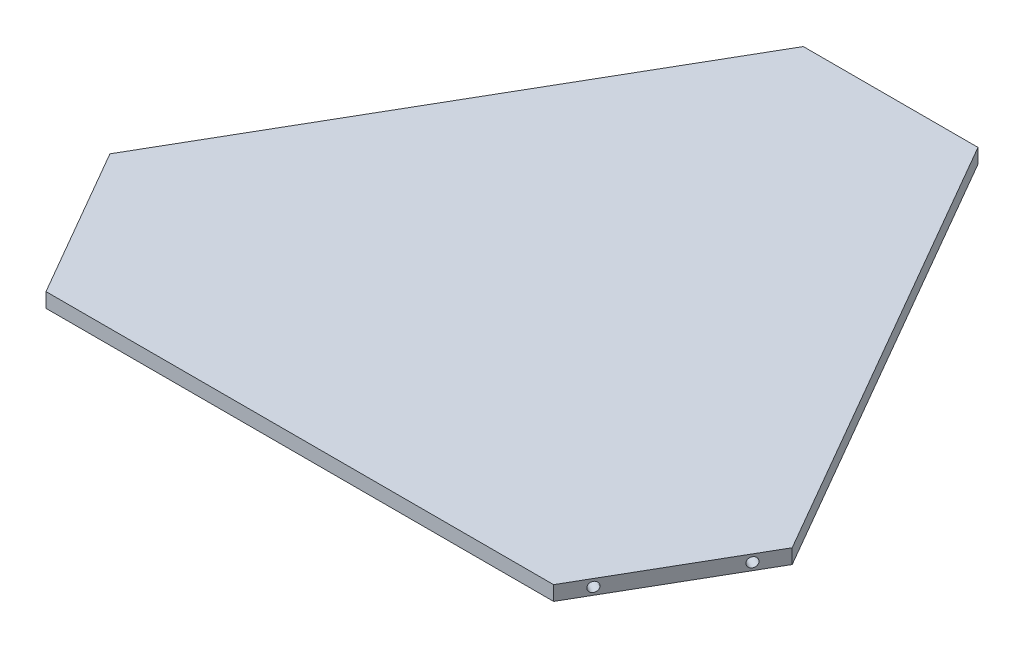
from build123d import *

# Parameters (mm, degrees)
BOSS_EXTRUDE1_DEPTH            = 6.35
M5X0_8_TAPPED_HOLE1_AT_2_COUNT = 2
M5X0_8_TAPPED_HOLE1_AT_2_PITCH = 50.8
CIRPATTERN1_COUNT              = 3


with BuildPart() as part:
    # Sketch1 → Boss-Extrude1 (new body)
    with BuildSketch(Plane(origin=(0, 0, 0), x_dir=(1, 0, 0), z_dir=(0, 1, 0))):
        Polygon((-148.832567011, -41.934432116), (-110.732567011, -107.925567884), (110.732567011, -107.925567884), (148.832567011, -41.934432116), (38.1, 149.86), (-38.1, 149.86), align=None)
    extrude(amount=BOSS_EXTRUDE1_DEPTH)

    # Sketch3 → M5x0.8 Tapped Hole1 (revolve, cut)
    with BuildSketch(Plane(origin=(117.082567011, 3.175, 96.927045256), x_dir=(0.5000000000000017, 0, -0.8660254037844378), z_dir=(0, 1, 0))):
        Polygon((0, 0), (0, 13.9618073), (2.1, 12.7), (2.1, 0), align=None)
    m5x0_8_tapped_hole1 = revolve(axis=Axis((122.581828325, 3.175, 100.102045256), (-0.8660254037844378, 0, -0.5000000000000017)), mode=Mode.SUBTRACT)

    # M5x0.8 Tapped Hole1 at 2: M5x0.8 Tapped Hole1 ×2
    with Locations(*[Vector(0.5000000000000017, 0, -0.8660254037844378) * (i * M5X0_8_TAPPED_HOLE1_AT_2_PITCH) for i in range(1, M5X0_8_TAPPED_HOLE1_AT_2_COUNT)]):
        add(m5x0_8_tapped_hole1, mode=Mode.SUBTRACT)

    # CirPattern1: M5x0.8 Tapped Hole1 ×3 about axis
    cirpattern1_axis = Axis((0, 6.6675, 0), (0, -1, 0))
    for i in range(1, CIRPATTERN1_COUNT):
        add(m5x0_8_tapped_hole1.rotate(cirpattern1_axis, i * 360 / CIRPATTERN1_COUNT), mode=Mode.SUBTRACT)

    # CirPattern1 copy 1 sketch → CirPattern1 copy 1 (revolve, cut)
    with BuildSketch(Plane(origin=(-117.082567011, 3.175, 96.927045256), x_dir=(0.4999999999999986, 0, 0.8660254037844395), z_dir=(0, 1, 0))):
        Polygon((0, 0), (0, 13.9618073), (2.1, 12.7), (2.1, 0), align=None)
    revolve(axis=Axis((-122.581828325, 3.175, 100.102045256), (0.8660254037844395, 0, -0.4999999999999986)), mode=Mode.SUBTRACT)

    # CirPattern1 copy 2 sketch → CirPattern1 copy 2 (revolve, cut)
    with BuildSketch(Plane(origin=(-25.4, 3.175, -149.86), x_dir=(-1, 0, 0), z_dir=(0, 1, 0))):
        Polygon((0, 0), (0, 13.9618073), (2.1, 12.7), (2.1, 0), align=None)
    revolve(axis=Axis((-25.4, 3.175, -156.21), (0, 0, 1)), mode=Mode.SUBTRACT)


solid = part.part
